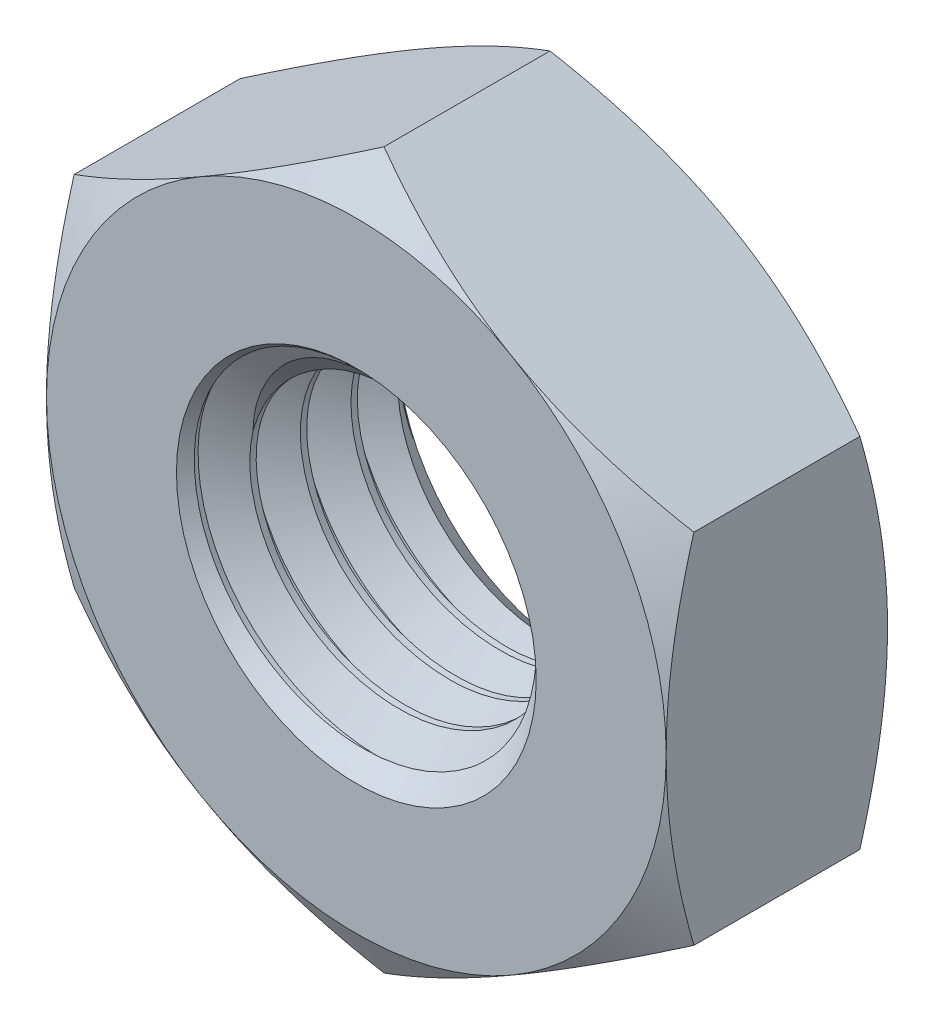
from build123d import *

# Parameters (mm, degrees)
EXTRUDE1_DEPTH     = 3.96875
SKETCH2_OUTSIDE_W  = 52.52
SKETCH2_OUTSIDE_H  = 54.24
SKETCH2_OUTSIDE_R  = 5.55625
CUT_EXTRUDE6_DEPTH = 10.369388598
CUT_EXTRUDE6_DRAFT = -60
SKETCH4_OUTSIDE_W  = 38.596
SKETCH4_OUTSIDE_H  = 40.316
SKETCH4_OUTSIDE_R  = 5.55625
CUT_EXTRUDE3_DEPTH = 6.35
CUT_EXTRUDE3_DRAFT = -60
SKETCH5_R          = 3.175
CUT_EXTRUDE4_DEPTH = 10.369388598
SWEEP1_PITCH       = 0.907142857
SKETCH8_R          = 3.683
CUT_EXTRUDE5_DEPTH = 11.600064531
CUT_EXTRUDE8_DEPTH = 10.3693887


with BuildPart() as part:
    # Sketch1 → Extrude1 (new body)
    with BuildSketch(Plane.XY):
        Polygon((0, 6.415804866), (-5.55625, 3.207902433), (-5.55625, -3.207902433), (0, -6.415804866), (5.55625, -3.207902433), (5.55625, 3.207902433), align=None)
    extrude(amount=-EXTRUDE1_DEPTH)


with BuildPart() as cut_extrude6_tool:
    # Sketch2 outside → Cut-Extrude6 (with draft: the straight prism first)
    with BuildSketch(Plane.XY):
        Rectangle(SKETCH2_OUTSIDE_W, SKETCH2_OUTSIDE_H)
        Circle(SKETCH2_OUTSIDE_R, mode=Mode.SUBTRACT)
    extrude(amount=-CUT_EXTRUDE6_DEPTH)
    # Cut-Extrude6: the draft: its side faces are tilted about the plane it starts from
    cut_extrude6_sides = [cut_extrude6_tool.faces().sort_by_distance(p)[0] for p in [
        (0, -27.12, -5.184694299),
        (26.26, 0, -5.184694299),
        (0, 27.12, -5.184694299),
        (-26.26, 0, -5.184694299),
        (-5.55625, 0, -5.184694299),
    ]]
    draft(cut_extrude6_sides, Plane.XY, CUT_EXTRUDE6_DRAFT)


with BuildPart() as part_1:
    add(part.part)

    # Cut-Extrude6: cut by cut_extrude6_tool
    add(cut_extrude6_tool.part, mode=Mode.SUBTRACT)


with BuildPart() as cut_extrude3_tool:
    # Sketch4 outside → Cut-Extrude3 (with draft: the straight prism first)
    with BuildSketch(Plane(origin=(0, 0, -3.96875), x_dir=(-1, 0, 0), z_dir=(0, 0, -1))):
        Rectangle(SKETCH4_OUTSIDE_W, SKETCH4_OUTSIDE_H)
        Circle(SKETCH4_OUTSIDE_R, mode=Mode.SUBTRACT)
    extrude(amount=-CUT_EXTRUDE3_DEPTH)
    # Cut-Extrude3: the draft: its side faces are tilted about the plane it starts from
    cut_extrude3_sides = [cut_extrude3_tool.faces().sort_by_distance(p)[0] for p in [
        (0, -20.158, -0.79375),
        (-19.298, 0, -0.79375),
        (0, 20.158, -0.79375),
        (19.298, 0, -0.79375),
        (5.55625, 0, -0.79375),
    ]]
    draft(cut_extrude3_sides, Plane(origin=(0, 0, -3.96875), x_dir=(-1, 0, 0), z_dir=(0, 0, -1)), CUT_EXTRUDE3_DRAFT)


with BuildPart() as part_2:
    add(part_1.part)

    # Cut-Extrude3: cut by cut_extrude3_tool
    add(cut_extrude3_tool.part, mode=Mode.SUBTRACT)

    # Sketch5 → Cut-Extrude4 (cut, through all)
    with BuildSketch(Plane.XY):
        Circle(SKETCH5_R)
    extrude(amount=-CUT_EXTRUDE4_DEPTH, mode=Mode.SUBTRACT)

    # Sweep1: the profile of Sketch7 profile screwed along a left-hand helix of 11.375 turns, 6 arcs to a turn; built about Z, then put on its axis
    sweep1_z = Axis((0, 0, 0), (0, 0, 1))
    sweep1_corners = [(3.1756, 0, -0.79409641), (3.1756, 0, 0.00034641), (2.585793431, 0, -0.340178571), (2.585793431, 0, -0.453571429)]
    with BuildLine(mode=Mode.PRIVATE) as sweep1_profile:
        Line(sweep1_corners[0], sweep1_corners[1])
        Line(sweep1_corners[1], sweep1_corners[2])
        Line(sweep1_corners[2], sweep1_corners[3])
        Line(sweep1_corners[3], sweep1_corners[0])
    sweep1_cap = Face(sweep1_profile.wire())
    sweep1_turn_angles = [0, -30, -60, -90, -120, -150, -180, -210, -240, -270, -300, -330, -360]
    sweep1_turn_weights = [1, 0.8660254037844387, 1, 0.8660254037844387, 1, 0.8660254037844387, 1, 0.8660254037844387, 1, 0.8660254037844387, 1, 0.8660254037844387, 1]
    sweep1_turn_rails = [Edge.make_bspline([Vector(p[0], p[1], 0).rotate(sweep1_z, sweep1_turn_angles[k]) / sweep1_turn_weights[k] + Vector(0, 0, p[2] + -SWEEP1_PITCH * sweep1_turn_angles[k] / 360) for k in range(13)], [0, 0, 0, 1, 1, 2, 2, 3, 3, 4, 4, 5, 5, 6, 6, 6], 2, sweep1_turn_weights) for p in sweep1_corners]
    sweep1_turn_sides = [Face.make_surface_from_curves(sweep1_turn_rails[p[0]], sweep1_turn_rails[p[1]]) for p in [(0, 1), (1, 2), (2, 3), (3, 0)]]
    sweep1_last_angles = [-3960, -3990, -4020, -4050, -4080, -4087.5, -4095]
    sweep1_last_weights = [1, 0.8660254037844387, 1, 0.8660254037844387, 1, 0.9914448613738073, 1]
    sweep1_last_rails = [Edge.make_bspline([Vector(p[0], p[1], 0).rotate(sweep1_z, sweep1_last_angles[k]) / sweep1_last_weights[k] + Vector(0, 0, p[2] + -SWEEP1_PITCH * sweep1_last_angles[k] / 360) for k in range(7)], [0, 0, 0, 1, 1, 2, 2, 3, 3, 3], 2, sweep1_last_weights) for p in sweep1_corners]
    sweep1_last_sides = [Face.make_surface_from_curves(sweep1_last_rails[p[0]], sweep1_last_rails[p[1]]) for p in [(0, 1), (1, 2), (2, 3), (3, 0)]]
    sweep1 = Plane(origin=(0, 0, 0), x_dir=(0, 1, 0), z_dir=(0, 0, -1)) * Solid(Shell([*[p.moved(Location((0, 0, SWEEP1_PITCH * i))) for i in range(11) for p in sweep1_turn_sides], *sweep1_last_sides, sweep1_cap, sweep1_cap.rotate(sweep1_z, -4095).moved(Location((0, 0, -SWEEP1_PITCH * -4095 / 360)))]))
    add(sweep1)

    # Sketch8 → Cut-Extrude5 (cut, through all)
    with BuildSketch(Plane(origin=(0, 0, -3.96875), x_dir=(-1, 0, 0), z_dir=(0, 0, -1))):
        Circle(SKETCH8_R)
    extrude(amount=CUT_EXTRUDE5_DEPTH, mode=Mode.SUBTRACT)

    # Sketch10 → Cut-Extrude8 (cut, through all)
    with BuildSketch(Plane.XY):
        with BuildLine():
            ThreePointArc((2.778125, -4.81185365), (4.81185365, -2.778125), (5.55625, 0))
            ThreePointArc((5.55625, 0), (4.81185365, 2.778125), (2.778125, 4.81185365))
            ThreePointArc((2.778125, 4.81185365), (0, 5.55625), (-2.778125, 4.81185365))
            ThreePointArc((-2.778125, 4.81185365), (-4.81185365, 2.778125), (-5.55625, 0))
            ThreePointArc((-5.55625, 0), (-4.81185365, -2.778125), (-2.778125, -4.81185365))
            ThreePointArc((-2.778125, -4.81185365), (0, -5.55625), (2.778125, -4.81185365))
        make_face()
    extrude(amount=CUT_EXTRUDE8_DEPTH, mode=Mode.SUBTRACT)

    # Cut-Extrude7 cone 1 section (through the dimple's axis) → Cut-Extrude7 (revolve, cut)
    with BuildSketch(Plane(origin=(0, 0, -3.96875), x_dir=(0, 1, 0), z_dir=(1, 0, 0))):
        Polygon((0, 0), (3.2258, 0), (0, 3.2258), align=None)
    revolve(axis=Axis((0, 0, -3.96875), (0, 0, 1)), mode=Mode.SUBTRACT)

    # Cut-Extrude9 cone 1 section (through the dimple's axis) → Cut-Extrude9 (revolve, cut)
    with BuildSketch(Plane(origin=(0, 0, 0), x_dir=(0, -1, 0), z_dir=(1, 0, 0))):
        Polygon((0, 0), (3.2258, 0), (0, 3.2258), align=None)
    revolve(axis=Axis((0, 0, 0), (0, 0, -1)), mode=Mode.SUBTRACT)


solid = part_2.part
